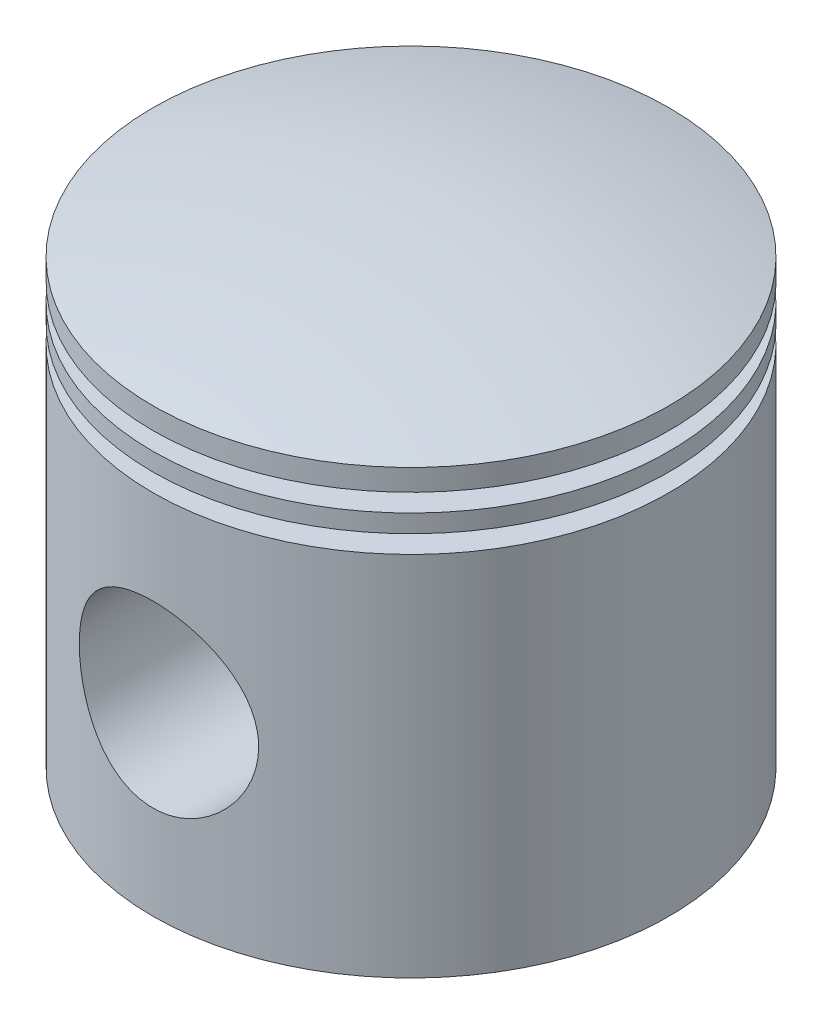
from build123d import *
from OCP.BRepAlgoAPI import BRepAlgoAPI_Cut
from OCP.TopTools import TopTools_ListOfShape

# Parameters (mm, degrees)
SKETCH1_W            = 18.581245514
SKETCH1_H            = 1.5
SKETCH2_R            = 7.5
CUT_EXTRUDE1_DEPTH   = 24.5
SHELL1_OUTLINE_R     = 18.581245514
SHELL1_DEPTH         = 27.672789125
SHELL1_START         = 27.672789125
SHELL1_2_OUTLINE_R   = 15.581245514
SHELL1_2_DEPTH       = 9.327210875
SHELL1_START_2       = 35.172789125
SHELL1_3_OUTLINE_R   = 18.581245514
SHELL1_3_OUTLINE_R_2 = 15.581245514
SHELL1_3_DEPTH       = 1.827210875
SHELL1_START_3       = -18.581245614
SHELL1_4_OUTLINE_R   = 10.5
SHELL1_4_OUTLINE_R_2 = 7.5
SHELL1_4_DEPTH       = 37.162490158
SKETCH3_W            = 25
SKETCH3_H            = 25
CUT_EXTRUDE2_DEPTH   = 7.5


with BuildPart() as part:
    # Sketch1 → Revolve1 (revolve)
    with BuildSketch(Plane.XY, mode=Mode.PRIVATE) as revolve1_sk:
        with BuildLine():
            Line((0, 40), (0, 36.972789125))
            Line((0, 36.972789125), (21.581245514, 36.972789125))
            ThreePointArc((21.581245514, 36.972789125), (10.896262703, 39.239510786), (0, 40))
        make_face()
        Polygon((0, 36.972789125), (0, 35.172789125), (18.581245514, 35.172789125), (21.581245514, 35.172789125), (21.581245514, 36.972789125), align=None)
        with Locations((9.290622757, 34.422789125)):
            Rectangle(SKETCH1_W, SKETCH1_H)
        Polygon((0, 33.672789125), (0, 32.172789125), (18.581245514, 32.172789125), (21.581245514, 32.172789125), (21.581245514, 33.672789125), (18.581245514, 33.672789125), align=None)
        with Locations((9.290622757, 31.422789125)):
            Rectangle(SKETCH1_W, SKETCH1_H)
        Polygon((0, 30.672789125), (0, 0), (21.581245514, 0), (21.581245514, 30.672789125), (18.581245514, 30.672789125), align=None)
    revolve(revolve1_sk.sketch.rotate(Axis((0, 0, 0), (0, 1, 0)), 90), axis=Axis((0, 0, 0), (0, 1, 0)))

    # Sketch2 → Cut-Extrude1 (cut, symmetric)
    with BuildSketch(Plane.XY):
        with Locations((0, 15.336394563)):
            Circle(SKETCH2_R)
    extrude(amount=CUT_EXTRUDE1_DEPTH, both=True, mode=Mode.SUBTRACT)


with BuildPart() as shell1_tool:
    # Shell1: read off the stored shape, not the designer's step
    # Shell1 outline → Shell1 (new body)
    with BuildSketch(Plane(origin=(0, 0, 0), x_dir=(1, 0, 0), z_dir=(0, 1, 0))):
        Circle(SHELL1_OUTLINE_R)
    extrude(amount=SHELL1_DEPTH)


with BuildPart() as part_1:
    add(part.part)

    # Shell1: cut by shell1_tool, with a tolerance
    shell1_stock = TopTools_ListOfShape()
    shell1_stock.Append(part_1.part.wrapped)
    shell1_tools = TopTools_ListOfShape()
    shell1_tools.Append(shell1_tool.part.wrapped)
    shell1_cut = BRepAlgoAPI_Cut()
    shell1_cut.SetArguments(shell1_stock)
    shell1_cut.SetTools(shell1_tools)
    shell1_cut.SetFuzzyValue(0.00001)
    shell1_cut.Build()
    add(Compound.cast(shell1_cut.Shape()).solids(), mode=Mode.REPLACE)


with BuildPart() as shell1_2_tool:
    # Shell1 2 outline → Shell1 2 (new body)
    with BuildSketch(Plane(origin=(0, 0, 0), x_dir=(1, 0, 0), z_dir=(0, 1, 0)).offset(SHELL1_START)):
        Circle(SHELL1_2_OUTLINE_R)
    extrude(amount=SHELL1_2_DEPTH)


with BuildPart() as part_2:
    add(part_1.part)

    # Shell1 2: cut by shell1_2_tool, with a tolerance
    shell1_2_stock = TopTools_ListOfShape()
    shell1_2_stock.Append(part_2.part.wrapped)
    shell1_2_tools = TopTools_ListOfShape()
    shell1_2_tools.Append(shell1_2_tool.part.wrapped)
    shell1_2_cut = BRepAlgoAPI_Cut()
    shell1_2_cut.SetArguments(shell1_2_stock)
    shell1_2_cut.SetTools(shell1_2_tools)
    shell1_2_cut.SetFuzzyValue(0.00001)
    shell1_2_cut.Build()
    add(Compound.cast(shell1_2_cut.Shape()).solids(), mode=Mode.REPLACE)


with BuildPart() as shell1_3_tool:
    # Shell1 3 outline → Shell1 3 (new body)
    with BuildSketch(Plane(origin=(0, 0, 0), x_dir=(1, 0, 0), z_dir=(0, 1, 0)).offset(SHELL1_START_2)):
        Circle(SHELL1_3_OUTLINE_R)
        Circle(SHELL1_3_OUTLINE_R_2, mode=Mode.SUBTRACT)
    extrude(amount=SHELL1_3_DEPTH)


with BuildPart() as part_3:
    add(part_2.part)

    # Shell1 3: cut by shell1_3_tool, with a tolerance
    shell1_3_stock = TopTools_ListOfShape()
    shell1_3_stock.Append(part_3.part.wrapped)
    shell1_3_tools = TopTools_ListOfShape()
    shell1_3_tools.Append(shell1_3_tool.part.wrapped)
    shell1_3_cut = BRepAlgoAPI_Cut()
    shell1_3_cut.SetArguments(shell1_3_stock)
    shell1_3_cut.SetTools(shell1_3_tools)
    shell1_3_cut.SetFuzzyValue(0.00001)
    shell1_3_cut.Build()
    add(Compound.cast(shell1_3_cut.Shape()).solids(), mode=Mode.REPLACE)


with BuildPart() as shell1_4_tool:
    # Shell1 4 outline → Shell1 4 (new body)
    with BuildSketch(Plane.XY.offset(SHELL1_START_3)):
        with Locations((0, 15.336394563)):
            Circle(SHELL1_4_OUTLINE_R)
        with Locations((0, 15.336394563)):
            Circle(SHELL1_4_OUTLINE_R_2, mode=Mode.SUBTRACT)
    extrude(amount=SHELL1_4_DEPTH)


with BuildPart() as part_4:
    add(part_3.part)


with BuildPart() as part_5:
    # Shell1 4: joined with shell1_4_tool
    add(part_4.part.fuse(shell1_4_tool.part, tol=0.00001))


with BuildPart() as shell1_5_tool:
    # Shell1 5 outline → Shell1 5 (revolve)
    with BuildSketch(Plane.XY):
        with BuildLine():
            Line((18.581245514, 37), (0, 37))
            ThreePointArc((0, 37), (8.301999629, 36.541805844), (16.503153993, 35.172789109))
            Line((16.503153993, 35.172789109), (18.581245514, 35.172789109))
            Line((18.581245514, 35.172789109), (18.581245514, 37))
        make_face()
    revolve(axis=Axis((0, 0, 0), (0, 1, 0)))


with BuildPart() as part_6:
    add(part_5.part)


with BuildPart() as part_7:
    # Shell1 5: joined with shell1_5_tool
    add(part_6.part.fuse(shell1_5_tool.part, tol=0.00001))

    # Sketch3 → Cut-Extrude2 (cut, symmetric)
    with BuildSketch(Plane.XY):
        with Locations((0, 15.336394563)):
            Rectangle(SKETCH3_W, SKETCH3_H)
    extrude(amount=CUT_EXTRUDE2_DEPTH, both=True, mode=Mode.SUBTRACT)


solid = part_7.part
